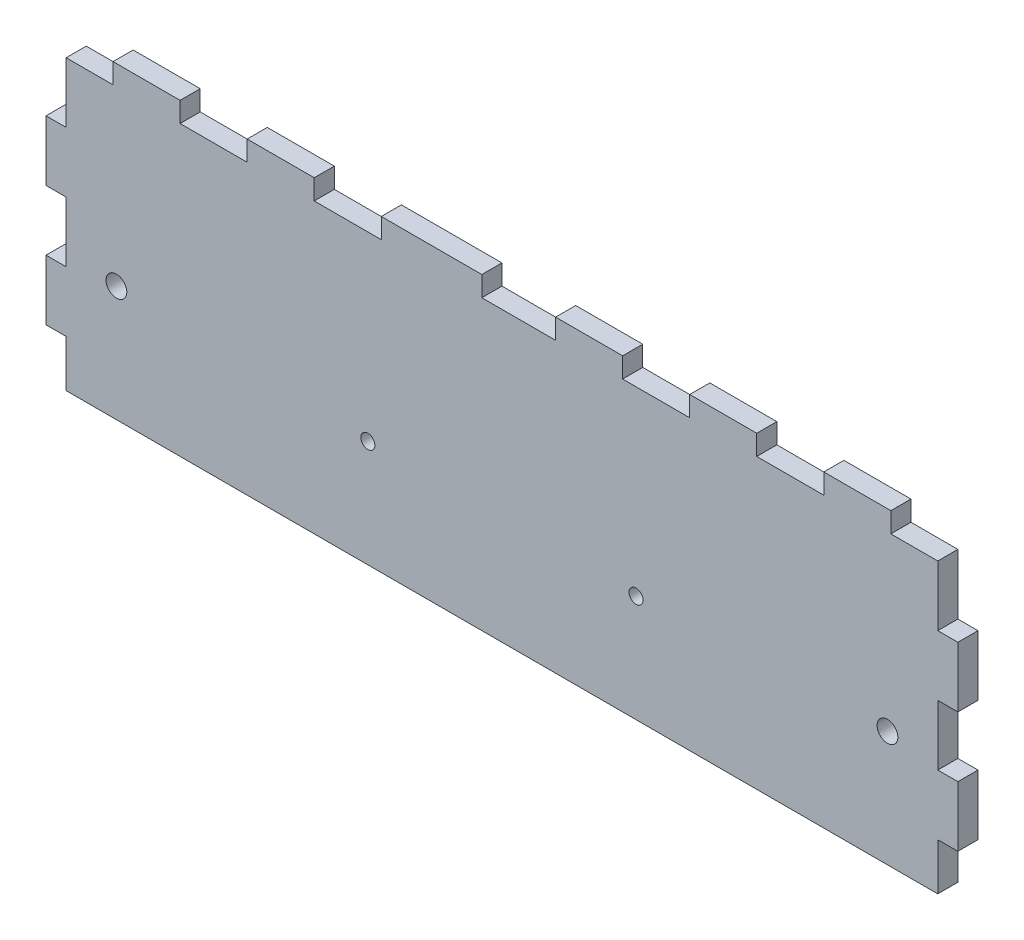
from build123d import *

# Parameters (mm, degrees)
SKETCH1_W           = 136
SKETCH1_H           = 46
SKETCH1_R           = 1.05
SKETCH1_R_2         = 1.55
BOSS_EXTRUDE1_DEPTH = 3
CUT_EXTRUDE1_REACH  = 145.6
SKETCH2_W           = 3
SKETCH2_H           = 9
SKETCH2_W_2         = 10
SKETCH2_H_2         = 3
SKETCH2_H_3         = 7
SKETCH2_W_3         = 11


with BuildPart() as part:
    # Sketch1 → Boss-Extrude1 (new body)
    with BuildSketch(Plane.XY):
        with Locations((-68, 23)):
            Rectangle(SKETCH1_W, SKETCH1_H)
        with Locations((-88, 15.95)):
            Circle(SKETCH1_R, mode=Mode.SUBTRACT)
        with Locations((-125.5, 17.25)):
            Circle(SKETCH1_R_2, mode=Mode.SUBTRACT)
        with Locations((-48, 15.95)):
            Circle(SKETCH1_R, mode=Mode.SUBTRACT)
        with Locations((-10.5, 17.25)):
            Circle(SKETCH1_R_2, mode=Mode.SUBTRACT)
    extrude(amount=BOSS_EXTRUDE1_DEPTH)

    # Sketch2 → Cut-Extrude1 (cut, up to next)
    with BuildSketch(Plane.XY.offset(3), mode=Mode.PRIVATE) as cut_extrude1_sk1:
        Polygon((-133, 34), (-133, 43), (-126, 43), (-126, 46), (-136, 46), (-136, 34), align=None)
    cut_extrude1_tool1 = extrude(cut_extrude1_sk1.sketch, amount=-CUT_EXTRUDE1_REACH, mode=Mode.PRIVATE) & part.part
    # Sketch2 → Cut-Extrude1 (cut, up to next)
    with BuildSketch(Plane.XY.offset(3), mode=Mode.PRIVATE) as cut_extrude1_sk2:
        with Locations((-134.5, 20.5)):
            Rectangle(SKETCH2_W, SKETCH2_H)
    cut_extrude1_tool2 = extrude(cut_extrude1_sk2.sketch, amount=-CUT_EXTRUDE1_REACH, mode=Mode.PRIVATE) & part.part
    # Sketch2 → Cut-Extrude1 (cut, up to next)
    with BuildSketch(Plane.XY.offset(3), mode=Mode.PRIVATE) as cut_extrude1_sk3:
        with Locations((-111, 44.5)):
            Rectangle(SKETCH2_W_2, SKETCH2_H_2)
    cut_extrude1_tool3 = extrude(cut_extrude1_sk3.sketch, amount=-CUT_EXTRUDE1_REACH, mode=Mode.PRIVATE) & part.part
    # Sketch2 → Cut-Extrude1 (cut, up to next)
    with BuildSketch(Plane.XY.offset(3), mode=Mode.PRIVATE) as cut_extrude1_sk4:
        with Locations((-134.5, 3.5)):
            Rectangle(SKETCH2_W, SKETCH2_H_3)
    cut_extrude1_tool4 = extrude(cut_extrude1_sk4.sketch, amount=-CUT_EXTRUDE1_REACH, mode=Mode.PRIVATE) & part.part
    # Sketch2 → Cut-Extrude1 (cut, up to next)
    with BuildSketch(Plane.XY.offset(3), mode=Mode.PRIVATE) as cut_extrude1_sk5:
        with Locations((-91, 44.5)):
            Rectangle(SKETCH2_W_2, SKETCH2_H_2)
    cut_extrude1_tool5 = extrude(cut_extrude1_sk5.sketch, amount=-CUT_EXTRUDE1_REACH, mode=Mode.PRIVATE) & part.part
    # Sketch2 → Cut-Extrude1 (cut, up to next)
    with BuildSketch(Plane.XY.offset(3), mode=Mode.PRIVATE) as cut_extrude1_sk6:
        with Locations((-65.5, 44.5)):
            Rectangle(SKETCH2_W_3, SKETCH2_H_2)
    cut_extrude1_tool6 = extrude(cut_extrude1_sk6.sketch, amount=-CUT_EXTRUDE1_REACH, mode=Mode.PRIVATE) & part.part
    # Sketch2 → Cut-Extrude1 (cut, up to next)
    with BuildSketch(Plane.XY.offset(3), mode=Mode.PRIVATE) as cut_extrude1_sk7:
        with Locations((-1.5, 3.5)):
            Rectangle(SKETCH2_W, SKETCH2_H_3)
    cut_extrude1_tool7 = extrude(cut_extrude1_sk7.sketch, amount=-CUT_EXTRUDE1_REACH, mode=Mode.PRIVATE) & part.part
    # Sketch2 → Cut-Extrude1 (cut, up to next)
    with BuildSketch(Plane.XY.offset(3), mode=Mode.PRIVATE) as cut_extrude1_sk8:
        with Locations((-45, 44.5)):
            Rectangle(SKETCH2_W_2, SKETCH2_H_2)
    cut_extrude1_tool8 = extrude(cut_extrude1_sk8.sketch, amount=-CUT_EXTRUDE1_REACH, mode=Mode.PRIVATE) & part.part
    # Sketch2 → Cut-Extrude1 (cut, up to next)
    with BuildSketch(Plane.XY.offset(3), mode=Mode.PRIVATE) as cut_extrude1_sk9:
        with Locations((-1.5, 20.5)):
            Rectangle(SKETCH2_W, SKETCH2_H)
    cut_extrude1_tool9 = extrude(cut_extrude1_sk9.sketch, amount=-CUT_EXTRUDE1_REACH, mode=Mode.PRIVATE) & part.part
    # Sketch2 → Cut-Extrude1 (cut, up to next)
    with BuildSketch(Plane.XY.offset(3), mode=Mode.PRIVATE) as cut_extrude1_sk10:
        with Locations((-25, 44.5)):
            Rectangle(SKETCH2_W_2, SKETCH2_H_2)
    cut_extrude1_tool10 = extrude(cut_extrude1_sk10.sketch, amount=-CUT_EXTRUDE1_REACH, mode=Mode.PRIVATE) & part.part
    # Sketch2 → Cut-Extrude1 (cut, up to next)
    with BuildSketch(Plane.XY.offset(3), mode=Mode.PRIVATE) as cut_extrude1_sk11:
        Polygon((-3, 34), (0, 34), (0, 46), (-10, 46), (-10, 43), (-3, 43), align=None)
    cut_extrude1_tool11 = extrude(cut_extrude1_sk11.sketch, amount=-CUT_EXTRUDE1_REACH, mode=Mode.PRIVATE) & part.part
    add(cut_extrude1_tool1.solids().sort_by_distance((-133.156205, 38.5, 3))[0], mode=Mode.SUBTRACT)
    add(cut_extrude1_tool2.solids().sort_by_distance((-134.5, 20.5, 3))[0], mode=Mode.SUBTRACT)
    add(cut_extrude1_tool3.solids().sort_by_distance((-111, 44.5, 3))[0], mode=Mode.SUBTRACT)
    add(cut_extrude1_tool4.solids().sort_by_distance((-134.5, 3.5, 3))[0], mode=Mode.SUBTRACT)
    add(cut_extrude1_tool5.solids().sort_by_distance((-91, 44.5, 3))[0], mode=Mode.SUBTRACT)
    add(cut_extrude1_tool6.solids().sort_by_distance((-65.5, 44.5, 3))[0], mode=Mode.SUBTRACT)
    add(cut_extrude1_tool7.solids().sort_by_distance((-1.5, 3.5, 3))[0], mode=Mode.SUBTRACT)
    add(cut_extrude1_tool8.solids().sort_by_distance((-45, 44.5, 3))[0], mode=Mode.SUBTRACT)
    add(cut_extrude1_tool9.solids().sort_by_distance((-1.5, 20.5, 3))[0], mode=Mode.SUBTRACT)
    add(cut_extrude1_tool10.solids().sort_by_distance((-25, 44.5, 3))[0], mode=Mode.SUBTRACT)
    add(cut_extrude1_tool11.solids().sort_by_distance((-1.5, 34.156205, 3))[0], mode=Mode.SUBTRACT)


solid = part.part
